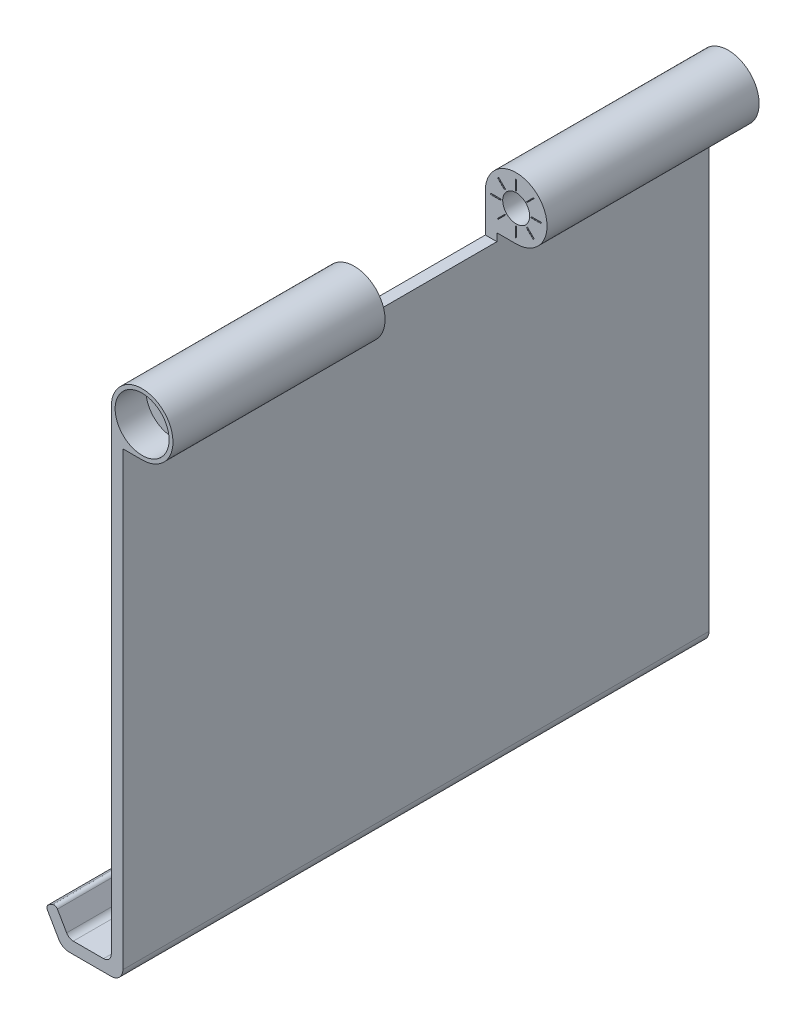
from build123d import *

# Parameters (mm, degrees)
BOSS_EXTRUDE1_DEPTH      = 76
BOSS_EXTRUDE1_DEPTH_BACK = 76
SKETCH2_R                = 8
FILLET1_R                = 3
FILLET2_R                = 2
FILLET3_R                = 1
CUT_EXTRUDE2_DEPTH       = 155.090108397
CUT_EXTRUDE2_DEPTH_BACK  = 155.090108397
SKETCH7_R                = 3.5
SKETCH9_R                = 7
CUT_EXTRUDE3_DEPTH       = 8
CUT_EXTRUDE4_DEPTH       = 155.090108397
CUT_EXTRUDE4_DEPTH_BACK  = 155.090108397
SKETCH10_W               = 42
SKETCH10_H               = 59.343909382
SKETCH11_W               = 0.2
SKETCH11_H               = 2.5
BOSS_EXTRUDE2_DEPTH      = 0.2
FILLET4_R                = 0.1
CIRPATTERN1_COUNT        = 8
FILLET4_OF_CIRPATTERN1_R = 0.1
MIRROR2_START            = 118.5
MIRROR2_DEPTH            = 2.5
MIRROR2_START_2          = 129
MIRROR2_2_DEPTH          = 2.5
MIRROR2_START_3          = 87.545201898
MIRROR2_3_DEPTH          = 2.5
MIRROR2_START_4          = 98.045201898
MIRROR2_4_DEPTH          = 2.5
MIRROR2_START_5          = 1.5
MIRROR2_5_DEPTH          = 2.5
MIRROR2_START_6          = 12
MIRROR2_6_DEPTH          = 2.5
MIRROR2_START_7          = -89.231493399
MIRROR2_7_DEPTH          = 2.5
MIRROR2_START_8          = -78.731493399
MIRROR2_8_DEPTH          = 2.5


# Read off the part's stored shape, not the designer's step: Mirror2
with BuildPart() as part:
    # Sketch2 → Boss-Extrude1 (new, two sides: drawn at the far end of the back side and taken through both)
    with BuildSketch(Plane.XY.offset(-BOSS_EXTRUDE1_DEPTH_BACK)):
        with Locations((8, 125)):
            Circle(SKETCH2_R)
        with BuildLine():
            ThreePointArc((8, 117), (5.350470229, 117.451490744), (3, 118.755002002))
            Line((3, 118.755002002), (3, 117))
            Line((3, 117), (8, 117))
        make_face()
        with BuildLine():
            Line((0, 125), (0, 0))
            Line((0, 0), (-11, 0))
            Line((-11, 0), (-14.464101615, 6))
            Line((-14.464101615, 6), (-17.062177826, 4.5))
            Line((-17.062177826, 4.5), (-12.732050808, -3))
            Line((-12.732050808, -3), (3, -3))
            Line((3, -3), (3, 117))
            Line((3, 117), (3, 118.755002002))
            ThreePointArc((3, 118.755002002), (0.788897449, 121.535898385), (0, 125))
        make_face()
    extrude(amount=BOSS_EXTRUDE1_DEPTH + BOSS_EXTRUDE1_DEPTH_BACK)

    # Fillet1
    fillet1_edges = [part.edges().sort_by_distance(p)[0] for p in [
        (3, -3, 0),
        (-12.732050808, -3, 0),
    ]]
    fillet(fillet1_edges, radius=FILLET1_R)

    # Fillet2
    fillet2_edges = [part.edges().sort_by_distance(p)[0] for p in [
        (-11, 0, 0),
        (0, 0, 0),
    ]]
    fillet(fillet2_edges, radius=FILLET2_R)

    # Fillet3
    fillet3_edges = [part.edges().sort_by_distance(p)[0] for p in [
        (-17.062177826, 4.5, 0),
        (-14.464101615, 6, 0),
    ]]
    fillet(fillet3_edges, radius=FILLET3_R)

    # Sketch7 → Cut-Extrude2 (cut, two sides: drawn at the far end of the back side and taken through both)
    with BuildSketch(Plane.XY.offset(-CUT_EXTRUDE2_DEPTH_BACK)):
        with Locations((8, 125)):
            Circle(SKETCH7_R)
    extrude(amount=CUT_EXTRUDE2_DEPTH + CUT_EXTRUDE2_DEPTH_BACK, mode=Mode.SUBTRACT)

    # Sketch9 → Cut-Extrude3 (cut)
    with BuildSketch(Plane.XY.offset(76)):
        with Locations((8, 125)):
            Circle(SKETCH9_R)
    cut_extrude3 = extrude(amount=-CUT_EXTRUDE3_DEPTH, mode=Mode.SUBTRACT)

    # Mirror1: Cut-Extrude3 across plane
    add(cut_extrude3.mirror(Plane.XY), mode=Mode.SUBTRACT)

    # Sketch10 → Cut-Extrude4 (cut, two sides: drawn at the far end of the back side and taken through both)
    with BuildSketch(Plane(origin=(0, 0, 0), x_dir=(0, 0, -1), z_dir=(1, 0, 0)).offset(-CUT_EXTRUDE4_DEPTH_BACK)):
        with Locations((0, 144.671954691)):
            Rectangle(SKETCH10_W, SKETCH10_H)
    extrude(amount=CUT_EXTRUDE4_DEPTH + CUT_EXTRUDE4_DEPTH_BACK, mode=Mode.SUBTRACT)

    # Sketch11 → Boss-Extrude2 (add)
    with BuildSketch(Plane.XY.offset(-21)):
        with Locations((8, 130.25)):
            Rectangle(SKETCH11_W, SKETCH11_H)
    boss_extrude2 = extrude(amount=BOSS_EXTRUDE2_DEPTH)

    # Fillet4
    fillet4_edges = [part.edges().sort_by_distance(p)[0] for p in [
        (8.1, 130.25, -20.8),
        (7.9, 130.25, -20.8),
    ]]
    fillet(fillet4_edges, radius=FILLET4_R - 0.0001)  # a hair under: the kernel refuses the full size

    # CirPattern1: Boss-Extrude2 ×8 about axis
    cirpattern1_axis = Axis((8, 125, 0), (0, 0, 1))
    for i in range(1, CIRPATTERN1_COUNT):
        add(boss_extrude2.rotate(cirpattern1_axis, i * 360 / CIRPATTERN1_COUNT))

    # Fillet4 of CirPattern1
    fillet4_of_cirpattern1_edges = [part.edges().sort_by_distance(p)[0] for p in [
        (4.358400077, 128.783021279, -20.8),
        (4.216978721, 128.641599923, -20.8),
        (2.75, 125.1, -20.8),
        (2.75, 124.9, -20.8),
        (4.216978721, 121.358400077, -20.8),
        (4.358400077, 121.216978721, -20.8),
        (7.9, 119.75, -20.8),
        (8.1, 119.75, -20.8),
        (11.641599923, 121.216978721, -20.8),
        (11.783021279, 121.358400077, -20.8),
        (13.25, 124.9, -20.8),
        (13.25, 125.1, -20.8),
        (11.783021279, 128.641599923, -20.8),
        (11.641599923, 128.783021279, -20.8),
    ]]
    fillet(fillet4_of_cirpattern1_edges, radius=FILLET4_OF_CIRPATTERN1_R - 0.0001)  # a hair under: the kernel refuses the full size

    # Mirror2 outline → Mirror2 (add)
    with BuildSketch(Plane(origin=(0, 0, 0), x_dir=(1, 0, 0), z_dir=(0, 1, 0)).offset(MIRROR2_START)):
        with BuildLine():
            Line((7.9, -21), (8.1, -21))
            Line((8.1, -21), (8.1, -20.9))
            ThreePointArc((8.1, -20.9), (8.070710678, -20.829289322), (8, -20.8))
            ThreePointArc((8, -20.8), (7.929289322, -20.829289322), (7.9, -20.9))
            Line((7.9, -20.9), (7.9, -21))
        make_face()
    extrude(amount=MIRROR2_DEPTH)

    # Mirror2 2 outline → Mirror2 2 (add)
    with BuildSketch(Plane(origin=(0, 0, 0), x_dir=(1, 0, 0), z_dir=(0, 1, 0)).offset(MIRROR2_START_2)):
        with BuildLine():
            Line((7.9, -21), (8.1, -21))
            Line((8.1, -21), (8.1, -20.9))
            ThreePointArc((8.1, -20.9), (8.070710678, -20.829289322), (8, -20.8))
            ThreePointArc((8, -20.8), (7.929289322, -20.829289322), (7.9, -20.9))
            Line((7.9, -20.9), (7.9, -21))
        make_face()
    extrude(amount=MIRROR2_2_DEPTH)

    # Mirror2 3 outline → Mirror2 3 (add)
    with BuildSketch(Plane(origin=(0, 0, 0), x_dir=(0.7071067811865471, -0.707106781186548, 0), z_dir=(0.707106781186548, 0.707106781186547, 0)).offset(MIRROR2_START_3)):
        with BuildLine():
            Line((-82.831493399, -21), (-82.631493399, -21))
            Line((-82.631493399, -21), (-82.631493399, -20.9))
            ThreePointArc((-82.631493399, -20.9), (-82.660782721, -20.829289322), (-82.731493399, -20.8))
            ThreePointArc((-82.731493399, -20.8), (-82.802204077, -20.829289322), (-82.831493399, -20.9))
            Line((-82.831493399, -20.9), (-82.831493399, -21))
        make_face()
    extrude(amount=MIRROR2_3_DEPTH)

    # Mirror2 4 outline → Mirror2 4 (add)
    with BuildSketch(Plane(origin=(0, 0, 0), x_dir=(0.7071067811865471, -0.707106781186548, 0), z_dir=(0.707106781186548, 0.707106781186547, 0)).offset(MIRROR2_START_4)):
        with BuildLine():
            Line((-82.831493399, -21), (-82.631493399, -21))
            Line((-82.631493399, -21), (-82.631493399, -20.9))
            ThreePointArc((-82.631493399, -20.9), (-82.660782721, -20.829289322), (-82.731493399, -20.8))
            ThreePointArc((-82.731493399, -20.8), (-82.802204077, -20.829289322), (-82.831493399, -20.9))
            Line((-82.831493399, -20.9), (-82.831493399, -21))
        make_face()
    extrude(amount=MIRROR2_4_DEPTH)

    # Mirror2 5 outline → Mirror2 5 (add)
    with BuildSketch(Plane.YZ.offset(MIRROR2_START_5)):
        with BuildLine():
            Line((125.1, 21), (124.9, 21))
            Line((124.9, 21), (124.9, 20.9))
            ThreePointArc((124.9, 20.9), (124.929289322, 20.829289322), (125, 20.8))
            ThreePointArc((125, 20.8), (125.070710678, 20.829289322), (125.1, 20.9))
            Line((125.1, 20.9), (125.1, 21))
        make_face()
    extrude(amount=MIRROR2_5_DEPTH)

    # Mirror2 6 outline → Mirror2 6 (add)
    with BuildSketch(Plane.YZ.offset(MIRROR2_START_6)):
        with BuildLine():
            Line((125.1, 21), (124.9, 21))
            Line((124.9, 21), (124.9, 20.9))
            ThreePointArc((124.9, 20.9), (124.929289322, 20.829289322), (125, 20.8))
            ThreePointArc((125, 20.8), (125.070710678, 20.829289322), (125.1, 20.9))
            Line((125.1, 20.9), (125.1, 21))
        make_face()
    extrude(amount=MIRROR2_6_DEPTH)

    # Mirror2 7 outline → Mirror2 7 (add)
    with BuildSketch(Plane(origin=(0, 0, 0), x_dir=(0.7071067811865509, 0.707106781186544, 0), z_dir=(0.707106781186544, -0.707106781186551, 0)).offset(MIRROR2_START_7)):
        with BuildLine():
            Line((94.145201898, 21), (93.945201898, 21))
            Line((93.945201898, 21), (93.945201898, 20.9))
            ThreePointArc((93.945201898, 20.9), (93.97449122, 20.829289322), (94.045201898, 20.8))
            ThreePointArc((94.045201898, 20.8), (94.115912576, 20.829289322), (94.145201898, 20.9))
            Line((94.145201898, 20.9), (94.145201898, 21))
        make_face()
    extrude(amount=MIRROR2_7_DEPTH)

    # Mirror2 8 outline → Mirror2 8 (add)
    with BuildSketch(Plane(origin=(0, 0, 0), x_dir=(0.7071067811865509, 0.707106781186544, 0), z_dir=(0.707106781186544, -0.707106781186551, 0)).offset(MIRROR2_START_8)):
        with BuildLine():
            Line((94.145201898, 21), (93.945201898, 21))
            Line((93.945201898, 21), (93.945201898, 20.9))
            ThreePointArc((93.945201898, 20.9), (93.97449122, 20.829289322), (94.045201898, 20.8))
            ThreePointArc((94.045201898, 20.8), (94.115912576, 20.829289322), (94.145201898, 20.9))
            Line((94.145201898, 20.9), (94.145201898, 21))
        make_face()
    extrude(amount=MIRROR2_8_DEPTH)


solid = part.part
